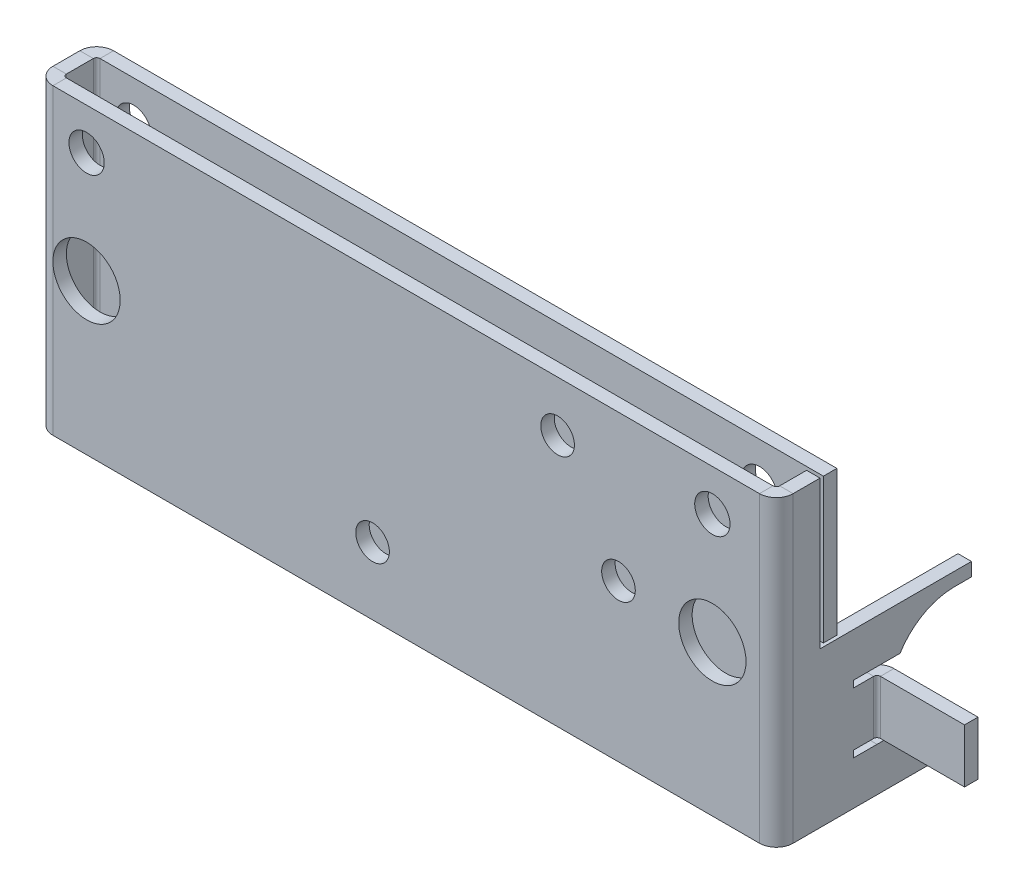
from build123d import *

# Parameters (mm, degrees)
SKETCH1_W              = 220
SKETCH1_H              = 90
SKETCH1_R              = 3
SKETCH1_R_2            = 5.25
BOSS_EXTRUDE1_DEPTH    = 4
SKETCH3_W              = 4
SKETCH3_H              = 90
BOSS_EXTRUDE2_DEPTH    = 10
SKETCH21_W             = 220
SKETCH21_H             = 90
SKETCH21_R             = 5.25
SKETCH21_R_2           = 10
SKETCH21_R_3           = 5
BOSS_EXTRUDE3_DEPTH    = 4
CUT_EXTRUDE4_REACH     = 240.109
SKETCH35_R             = 5
BOSS_EXTRUDE6_DEPTH    = 4
SKETCH33_W             = 1
SKETCH33_H             = 43.95
CUT_EXTRUDE2_DEPTH     = 4
CUT_EXTRUDE3_DEPTH     = 4
SKETCH41_W             = 4
SKETCH41_H             = 16
BOSS_EXTRUDE8_DEPTH    = 26
CONVERT_SOLID4_DEPTH   = 90
CONVERT_SOLID4_START   = 13
CONVERT_SOLID4_2_DEPTH = 20
CONVERT_SOLID4_3_DEPTH = 2
CONVERT_SOLID4_START_2 = 31
CONVERT_SOLID4_4_DEPTH = 2
CONVERT_SOLID4_5_DEPTH = 90
CONVERT_SOLID4_START_3 = 15
CONVERT_SOLID4_6_DEPTH = 16


# Read off the part's stored shape, not the designer's step: Convert-Solid4
with BuildPart() as part:
    # Sketch1 → Boss-Extrude1 (new body)
    with BuildSketch(Plane.XY):
        with Locations((110, 45)):
            Rectangle(SKETCH1_W, SKETCH1_H)
        with Locations((201, 44.75)):
            Circle(SKETCH1_R, mode=Mode.SUBTRACT)
        with Locations((201, 77.75)):
            Circle(SKETCH1_R_2, mode=Mode.SUBTRACT)
        with Locations((15, 44.75)):
            Circle(SKETCH1_R, mode=Mode.SUBTRACT)
        with Locations((15, 77.75)):
            Circle(SKETCH1_R_2, mode=Mode.SUBTRACT)
    extrude(amount=BOSS_EXTRUDE1_DEPTH)

    # Sketch3 → Boss-Extrude2 (add)
    with BuildSketch(Plane.XY.offset(4)):
        with Locations((2, 45)):
            Rectangle(SKETCH3_W, SKETCH3_H)
        with Locations((218, 45)):
            Rectangle(SKETCH3_W, SKETCH3_H)
    extrude(amount=BOSS_EXTRUDE2_DEPTH)

    # Sketch21 → Boss-Extrude3 (add)
    with BuildSketch(Plane.XY.offset(14)):
        with Locations((110, 45)):
            Rectangle(SKETCH21_W, SKETCH21_H)
        with Locations((201, 77.75)):
            Circle(SKETCH21_R, mode=Mode.SUBTRACT)
        with Locations((15, 77.75)):
            Circle(SKETCH21_R, mode=Mode.SUBTRACT)
        with Locations((15, 44.75)):
            Circle(SKETCH21_R_2, mode=Mode.SUBTRACT)
        with Locations((201, 44.75)):
            Circle(SKETCH21_R_2, mode=Mode.SUBTRACT)
        with Locations((100, 20)):
            Circle(SKETCH21_R_3, mode=Mode.SUBTRACT)
        with Locations((173.090932683, 46.602923891)):
            Circle(SKETCH21_R_3, mode=Mode.SUBTRACT)
        with Locations((155, 75)):
            Circle(SKETCH21_R_3, mode=Mode.SUBTRACT)
    extrude(amount=BOSS_EXTRUDE3_DEPTH)

    # Sketch35 → Cut-Extrude4 (cut, up to next)
    with BuildSketch(Plane.XY.offset(4), mode=Mode.PRIVATE) as cut_extrude4_sk1:
        with Locations((100, 20)):
            Circle(SKETCH35_R)
    cut_extrude4_tool1 = extrude(cut_extrude4_sk1.sketch, amount=-CUT_EXTRUDE4_REACH, mode=Mode.PRIVATE) & part.part
    # Sketch35 → Cut-Extrude4 (cut, up to next)
    with BuildSketch(Plane.XY.offset(4), mode=Mode.PRIVATE) as cut_extrude4_sk2:
        with Locations((173.090932683, 46.602923891)):
            Circle(SKETCH35_R)
    cut_extrude4_tool2 = extrude(cut_extrude4_sk2.sketch, amount=-CUT_EXTRUDE4_REACH, mode=Mode.PRIVATE) & part.part
    # Sketch35 → Cut-Extrude4 (cut, up to next)
    with BuildSketch(Plane.XY.offset(4), mode=Mode.PRIVATE) as cut_extrude4_sk3:
        with Locations((155, 75)):
            Circle(SKETCH35_R)
    cut_extrude4_tool3 = extrude(cut_extrude4_sk3.sketch, amount=-CUT_EXTRUDE4_REACH, mode=Mode.PRIVATE) & part.part
    add(cut_extrude4_tool1.solids().sort_by_distance((100, 20, 4))[0], mode=Mode.SUBTRACT)
    add(cut_extrude4_tool2.solids().sort_by_distance((173.090933, 46.602924, 4))[0], mode=Mode.SUBTRACT)
    add(cut_extrude4_tool3.solids().sort_by_distance((155, 75, 4))[0], mode=Mode.SUBTRACT)

    # Sketch24 → Boss-Extrude6 (add)
    with BuildSketch(Plane(origin=(220, 0, 0), x_dir=(0, 0, -1), z_dir=(1, 0, 0))):
        with BuildLine():
            Line((40, 42.05), (40, 46.05))
            Line((40, 46.05), (0, 46.05))
            Line((0, 46.05), (0, 0))
            Line((0, 0), (40, 0))
            Line((40, 0), (40, 3.95))
            Line((40, 3.95), (35, 3.95))
            ThreePointArc((35, 3.95), (25.715537172, 6.365660518), (18.785731592, 13))
            Line((18.785731592, 13), (15.95, 13))
            Line((15.95, 13), (15.95, 33))
            Line((15.95, 33), (18.785731592, 33))
            ThreePointArc((18.785731592, 33), (25.715537172, 39.634339482), (35, 42.05))
            Line((35, 42.05), (40, 42.05))
        make_face()
    extrude(amount=-BOSS_EXTRUDE6_DEPTH)

    # Sketch33 → Cut-Extrude2 (cut)
    with BuildSketch(Plane(origin=(220, 0, 0), x_dir=(0, 0, -1), z_dir=(1, 0, 0))):
        with Locations((-4.5, 68.025)):
            Rectangle(SKETCH33_W, SKETCH33_H)
    extrude(amount=-CUT_EXTRUDE2_DEPTH, mode=Mode.SUBTRACT)

    # Sketch34 → Cut-Extrude3 (cut)
    with BuildSketch(Plane(origin=(0, 0, 0), x_dir=(-1, 0, 0), z_dir=(0, 0, -1))):
        Polygon((-216, 0), (-215, 0), (-215, 47.05), (-220, 47.05), (-220, 46.05), (-216, 46.05), align=None)
    extrude(amount=-CUT_EXTRUDE3_DEPTH, mode=Mode.SUBTRACT)

    # Sketch41 → Boss-Extrude8 (add)
    with BuildSketch(Plane(origin=(220, 0, 0), x_dir=(0, 0, -1), z_dir=(1, 0, 0))):
        with Locations((13.95, 23)):
            Rectangle(SKETCH41_W, SKETCH41_H)
    extrude(amount=BOSS_EXTRUDE8_DEPTH)

    # Convert-Solid4 outline → Convert-Solid4 (cut)
    with BuildSketch(Plane(origin=(0, 0, 0), x_dir=(1, 0, 0), z_dir=(0, 1, 0))):
        with BuildLine():
            Line((220, 15.95), (220, 15.848979486))
            ThreePointArc((220, 15.848979486), (220.49745519, 15.924680765), (221, 15.95))
            Line((221, 15.95), (220, 15.95))
        make_face()
        with BuildLine():
            ThreePointArc((0, -5), (1.464466094, -1.464466094), (5, 0))
            Line((5, 0), (0, 0))
            Line((0, 0), (0, -5))
        make_face()
        with BuildLine():
            Line((220, -18), (220, -13))
            ThreePointArc((220, -13), (218.535533906, -16.535533906), (215, -18))
            Line((215, -18), (220, -18))
        make_face()
        with BuildLine():
            ThreePointArc((5, -18), (1.464466094, -16.535533906), (0, -13))
            Line((0, -13), (0, -18))
            Line((0, -18), (5, -18))
        make_face()
    extrude(amount=CONVERT_SOLID4_DEPTH, mode=Mode.SUBTRACT)

    # Convert-Solid4 2 outline → Convert-Solid4 2 (cut)
    with BuildSketch(Plane(origin=(0, 0, 0), x_dir=(1, 0, 0), z_dir=(0, 1, 0)).offset(CONVERT_SOLID4_START)):
        with BuildLine():
            Line((216, 15.95), (216, 10.95))
            ThreePointArc((216, 10.95), (217.127016654, 14.11227766), (220, 15.848979486))
            Line((220, 15.848979486), (220, 15.95))
            Line((220, 15.95), (216, 15.95))
        make_face()
    extrude(amount=CONVERT_SOLID4_2_DEPTH, mode=Mode.SUBTRACT)

    # Convert-Solid4 3 outline → Convert-Solid4 3 (cut)
    with BuildSketch(Plane(origin=(0, 0, 0), x_dir=(1, 0, 0), z_dir=(0, 1, 0)).offset(CONVERT_SOLID4_START)):
        with BuildLine():
            Line((216, 10.95), (216, 4.95))
            Line((216, 4.95), (220, 4.95))
            Line((220, 4.95), (220, 15.848979486))
            ThreePointArc((220, 15.848979486), (217.127016654, 14.11227766), (216, 10.95))
        make_face()
    extrude(amount=CONVERT_SOLID4_3_DEPTH, mode=Mode.SUBTRACT)

    # Convert-Solid4 4 outline → Convert-Solid4 4 (cut)
    with BuildSketch(Plane(origin=(0, 0, 0), x_dir=(1, 0, 0), z_dir=(0, 1, 0)).offset(CONVERT_SOLID4_START_2)):
        with BuildLine():
            Line((216, 10.95), (216, 4.95))
            Line((216, 4.95), (220, 4.95))
            Line((220, 4.95), (220, 15.848979486))
            ThreePointArc((220, 15.848979486), (217.127016654, 14.11227766), (216, 10.95))
        make_face()
    extrude(amount=CONVERT_SOLID4_4_DEPTH, mode=Mode.SUBTRACT)

    # Convert-Solid4 5 outline → Convert-Solid4 5 (add)
    with BuildSketch(Plane(origin=(0, 0, 0), x_dir=(1, 0, 0), z_dir=(0, 1, 0))):
        with BuildLine():
            Line((216, -14), (216, -13))
            ThreePointArc((216, -13), (215.707106781, -13.707106781), (215, -14))
            Line((215, -14), (216, -14))
        make_face()
        with BuildLine():
            ThreePointArc((4, -5), (4.292893219, -4.292893219), (5, -4))
            Line((5, -4), (4, -4))
            Line((4, -4), (4, -5))
        make_face()
        with BuildLine():
            Line((4, -14), (5, -14))
            ThreePointArc((5, -14), (4.292893219, -13.707106781), (4, -13))
            Line((4, -13), (4, -14))
        make_face()
    extrude(amount=CONVERT_SOLID4_5_DEPTH)

    # Convert-Solid4 6 outline → Convert-Solid4 6 (add)
    with BuildSketch(Plane(origin=(0, 0, 0), x_dir=(1, 0, 0), z_dir=(0, 1, 0)).offset(CONVERT_SOLID4_START_3)):
        with BuildLine():
            Line((220, 11.95), (220, 10.95))
            ThreePointArc((220, 10.95), (220.292893219, 11.657106781), (221, 11.95))
            Line((221, 11.95), (220, 11.95))
        make_face()
    extrude(amount=CONVERT_SOLID4_6_DEPTH)


solid = part.part
